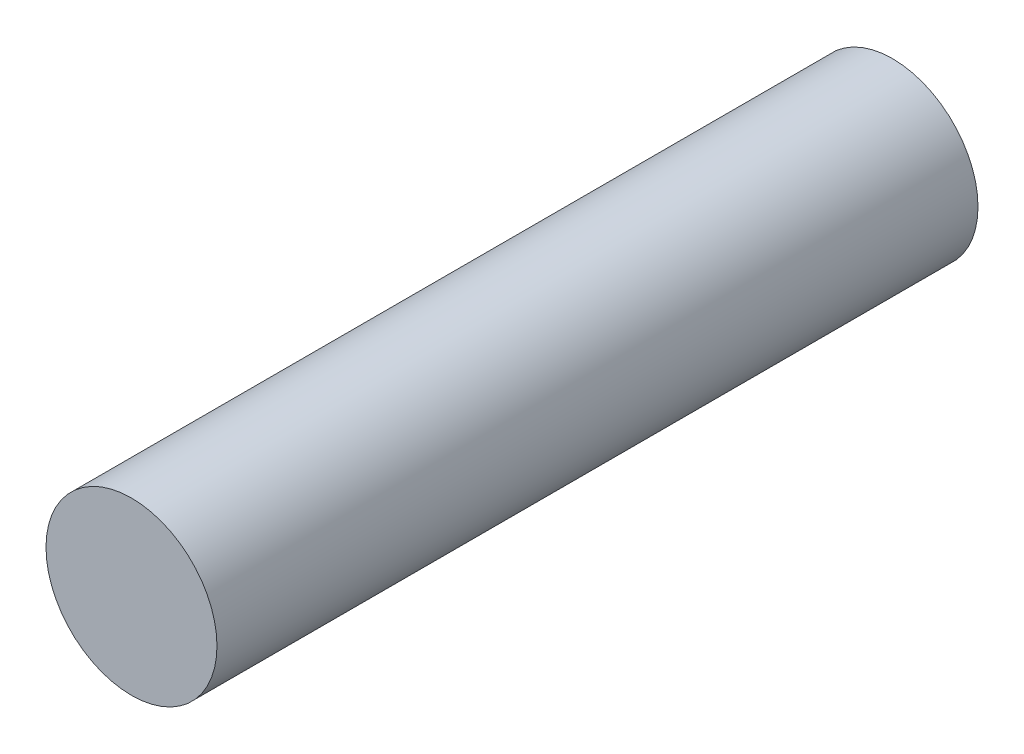
from build123d import *

# Parameters (mm, degrees)
SKETCH_1_R      = 3.37
EXTRUDE_1_DEPTH = 30


with BuildPart() as part:
    # 草图1 → 凸台-拉伸1 (new body)
    with BuildSketch(Plane.XY):
        Circle(SKETCH_1_R)
    extrude(amount=EXTRUDE_1_DEPTH)


solid = part.part
